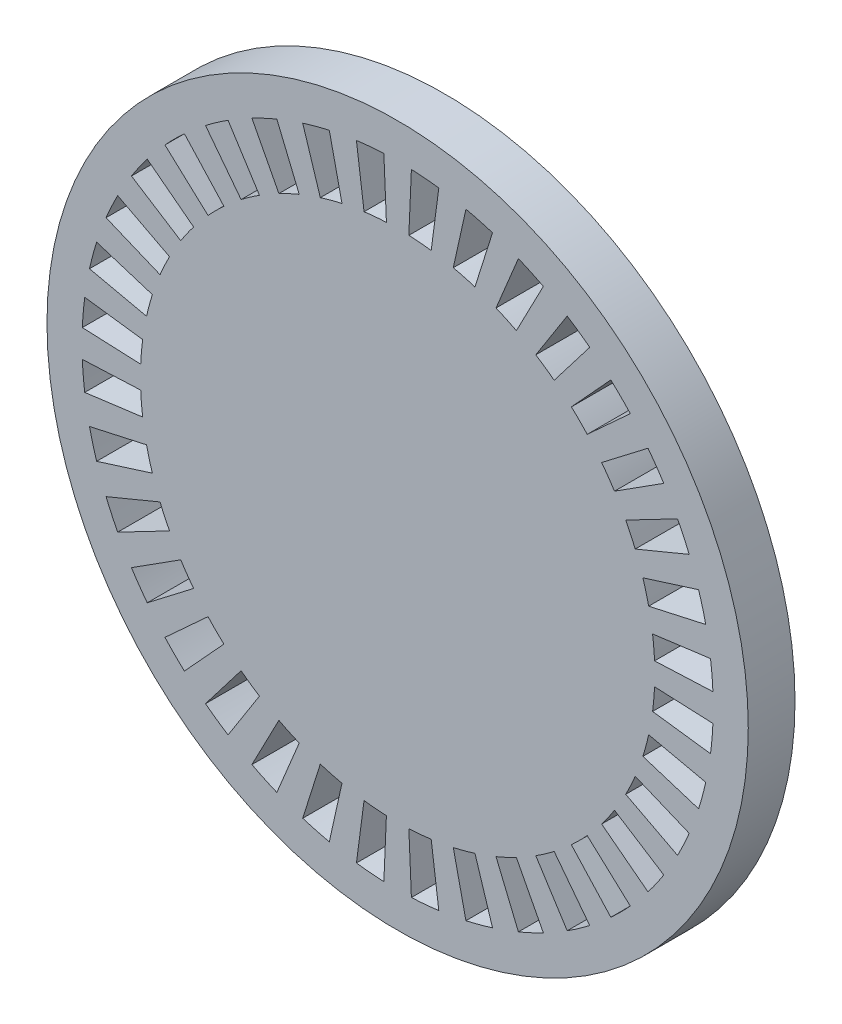
from build123d import *

# Parameters (mm, degrees)
ESQUISSE1_R        = 30
BOSS_EXTRU_1_DEPTH = 4


with BuildPart() as part:
    # Esquisse1 → Boss.-Extru.1 (new body)
    with BuildSketch(Plane.XY):
        Circle(ESQUISSE1_R)
        with BuildLine():
            Line((-26.974301983, -1.177723459), (-21.979060875, -0.959626522))
            ThreePointArc((-21.979060875, -0.959626522), (-21.916283358, -1.91742634), (-21.81178695, -2.871576229))
            Line((-21.81178695, -2.871576229), (-26.769011257, -3.52420719))
            ThreePointArc((-26.769011257, -3.52420719), (-26.897256848, -2.353205054), (-26.974301983, -1.177723459))
        make_face(mode=Mode.SUBTRACT)
        with BuildLine():
            Line((-21.979060875, 0.959626522), (-26.974301983, 1.177723459))
            ThreePointArc((-26.974301983, 1.177723459), (-26.897256848, 2.353205054), (-26.769011257, 3.52420719))
            Line((-26.769011257, 3.52420719), (-21.81178695, 2.871576229))
            ThreePointArc((-21.81178695, 2.871576229), (-21.916283358, 1.91742634), (-21.979060875, 0.959626522))
        make_face(mode=Mode.SUBTRACT)
        with BuildLine():
            ThreePointArc((-20.981772916, 6.615527589), (-21.250368178, 5.694018992), (-21.478512157, 4.761671507))
            Line((-21.478512157, 4.761671507), (-26.359992192, 5.843869576))
            ThreePointArc((-26.359992192, 5.843869576), (-26.07999731, 6.988114218), (-25.75035767, 8.119056587))
            Line((-25.75035767, 8.119056587), (-20.981772916, 6.615527589))
        make_face(mode=Mode.SUBTRACT)
        with BuildLine():
            ThreePointArc((-19.51423833, 10.158469491), (-19.938771315, 9.297601758), (-20.325349715, 8.419035512))
            Line((-20.325349715, 8.419035512), (-24.944747378, 10.332452674))
            ThreePointArc((-24.944747378, 10.332452674), (-24.47031025, 11.410693067), (-23.949292496, 12.467212557))
            Line((-23.949292496, 12.467212557), (-19.51423833, 10.158469491))
        make_face(mode=Mode.SUBTRACT)
        with BuildLine():
            ThreePointArc((-17.453773486, 13.392751438), (-18.021344974, 12.6186816), (-18.554611808, 11.820591384))
            Line((-18.554611808, 11.820591384), (-22.771569037, 14.507089425))
            ThreePointArc((-22.771569037, 14.507089425), (-22.117105196, 15.486563781), (-21.420540188, 16.436558583))
            Line((-21.420540188, 16.436558583), (-17.453773486, 13.392751438))
        make_face(mode=Mode.SUBTRACT)
        with BuildLine():
            ThreePointArc((-14.862984568, 16.22010141), (-15.556349186, 15.556349186), (-16.22010141, 14.862984568))
            Line((-16.22010141, 14.862984568), (-19.906488094, 18.240935606))
            ThreePointArc((-19.906488094, 18.240935606), (-19.091883092, 19.091883092), (-18.240935606, 19.906488094))
            Line((-18.240935606, 19.906488094), (-14.862984568, 16.22010141))
        make_face(mode=Mode.SUBTRACT)
        with BuildLine():
            ThreePointArc((-11.820591384, 18.554611808), (-12.6186816, 18.021344974), (-13.392751438, 17.453773486))
            Line((-13.392751438, 17.453773486), (-16.436558583, 21.420540188))
            ThreePointArc((-16.436558583, 21.420540188), (-15.486563781, 22.117105196), (-14.507089425, 22.771569037))
            Line((-14.507089425, 22.771569037), (-11.820591384, 18.554611808))
        make_face(mode=Mode.SUBTRACT)
        with BuildLine():
            ThreePointArc((-8.419035512, 20.325349715), (-9.297601758, 19.938771315), (-10.158469491, 19.51423833))
            Line((-10.158469491, 19.51423833), (-12.467212557, 23.949292496))
            ThreePointArc((-12.467212557, 23.949292496), (-11.410693067, 24.47031025), (-10.332452674, 24.944747378))
            Line((-10.332452674, 24.944747378), (-8.419035512, 20.325349715))
        make_face(mode=Mode.SUBTRACT)
        with BuildLine():
            ThreePointArc((-4.761671507, 21.478512157), (-5.694018992, 21.250368178), (-6.615527589, 20.981772916))
            Line((-6.615527589, 20.981772916), (-8.119056587, 25.75035767))
            ThreePointArc((-8.119056587, 25.75035767), (-6.988114218, 26.07999731), (-5.843869576, 26.359992192))
            Line((-5.843869576, 26.359992192), (-4.761671507, 21.478512157))
        make_face(mode=Mode.SUBTRACT)
        with BuildLine():
            ThreePointArc((-0.959626522, 21.979060875), (-1.91742634, 21.916283358), (-2.871576229, 21.81178695))
            Line((-2.871576229, 21.81178695), (-3.52420719, 26.769011257))
            ThreePointArc((-3.52420719, 26.769011257), (-2.353205054, 26.897256848), (-1.177723459, 26.974301983))
            Line((-1.177723459, 26.974301983), (-0.959626522, 21.979060875))
        make_face(mode=Mode.SUBTRACT)
        with BuildLine():
            ThreePointArc((2.871576229, 21.81178695), (1.91742634, 21.916283358), (0.959626522, 21.979060875))
            Line((0.959626522, 21.979060875), (1.177723459, 26.974301983))
            ThreePointArc((1.177723459, 26.974301983), (2.353205054, 26.897256848), (3.52420719, 26.769011257))
            Line((3.52420719, 26.769011257), (2.871576229, 21.81178695))
        make_face(mode=Mode.SUBTRACT)
        with BuildLine():
            ThreePointArc((6.615527589, 20.981772916), (5.694018992, 21.250368178), (4.761671507, 21.478512157))
            Line((4.761671507, 21.478512157), (5.843869576, 26.359992192))
            ThreePointArc((5.843869576, 26.359992192), (6.988114218, 26.07999731), (8.119056587, 25.75035767))
            Line((8.119056587, 25.75035767), (6.615527589, 20.981772916))
        make_face(mode=Mode.SUBTRACT)
        with BuildLine():
            ThreePointArc((10.158469491, 19.51423833), (9.297601758, 19.938771315), (8.419035512, 20.325349715))
            Line((8.419035512, 20.325349715), (10.332452674, 24.944747378))
            ThreePointArc((10.332452674, 24.944747378), (11.410693067, 24.47031025), (12.467212557, 23.949292496))
            Line((12.467212557, 23.949292496), (10.158469491, 19.51423833))
        make_face(mode=Mode.SUBTRACT)
        with BuildLine():
            ThreePointArc((13.392751438, 17.453773486), (12.6186816, 18.021344974), (11.820591384, 18.554611808))
            Line((11.820591384, 18.554611808), (14.507089425, 22.771569037))
            ThreePointArc((14.507089425, 22.771569037), (15.486563781, 22.117105196), (16.436558583, 21.420540188))
            Line((16.436558583, 21.420540188), (13.392751438, 17.453773486))
        make_face(mode=Mode.SUBTRACT)
        with BuildLine():
            ThreePointArc((16.22010141, 14.862984568), (15.556349186, 15.556349186), (14.862984568, 16.22010141))
            Line((14.862984568, 16.22010141), (18.240935606, 19.906488094))
            ThreePointArc((18.240935606, 19.906488094), (19.091883092, 19.091883092), (19.906488094, 18.240935606))
            Line((19.906488094, 18.240935606), (16.22010141, 14.862984568))
        make_face(mode=Mode.SUBTRACT)
        with BuildLine():
            ThreePointArc((18.554611808, 11.820591384), (18.021344974, 12.6186816), (17.453773486, 13.392751438))
            Line((17.453773486, 13.392751438), (21.420540188, 16.436558583))
            ThreePointArc((21.420540188, 16.436558583), (22.117105196, 15.486563781), (22.771569037, 14.507089425))
            Line((22.771569037, 14.507089425), (18.554611808, 11.820591384))
        make_face(mode=Mode.SUBTRACT)
        with BuildLine():
            ThreePointArc((20.325349715, 8.419035512), (19.938771315, 9.297601758), (19.51423833, 10.158469491))
            Line((19.51423833, 10.158469491), (23.949292496, 12.467212557))
            ThreePointArc((23.949292496, 12.467212557), (24.47031025, 11.410693067), (24.944747378, 10.332452674))
            Line((24.944747378, 10.332452674), (20.325349715, 8.419035512))
        make_face(mode=Mode.SUBTRACT)
        with BuildLine():
            ThreePointArc((21.478512157, 4.761671507), (21.250368178, 5.694018992), (20.981772916, 6.615527589))
            Line((20.981772916, 6.615527589), (25.75035767, 8.119056587))
            ThreePointArc((25.75035767, 8.119056587), (26.07999731, 6.988114218), (26.359992192, 5.843869576))
            Line((26.359992192, 5.843869576), (21.478512157, 4.761671507))
        make_face(mode=Mode.SUBTRACT)
        with BuildLine():
            ThreePointArc((21.979060875, 0.959626522), (21.916283358, 1.91742634), (21.81178695, 2.871576229))
            Line((21.81178695, 2.871576229), (26.769011257, 3.52420719))
            ThreePointArc((26.769011257, 3.52420719), (26.897256848, 2.353205054), (26.974301983, 1.177723459))
            Line((26.974301983, 1.177723459), (21.979060875, 0.959626522))
        make_face(mode=Mode.SUBTRACT)
        with BuildLine():
            ThreePointArc((21.81178695, -2.871576229), (21.916283358, -1.91742634), (21.979060875, -0.959626522))
            Line((21.979060875, -0.959626522), (26.974301983, -1.177723459))
            ThreePointArc((26.974301983, -1.177723459), (26.897256848, -2.353205054), (26.769011257, -3.52420719))
            Line((26.769011257, -3.52420719), (21.81178695, -2.871576229))
        make_face(mode=Mode.SUBTRACT)
        with BuildLine():
            ThreePointArc((20.981772916, -6.615527589), (21.250368178, -5.694018992), (21.478512157, -4.761671507))
            Line((21.478512157, -4.761671507), (26.359992192, -5.843869576))
            ThreePointArc((26.359992192, -5.843869576), (26.07999731, -6.988114218), (25.75035767, -8.119056587))
            Line((25.75035767, -8.119056587), (20.981772916, -6.615527589))
        make_face(mode=Mode.SUBTRACT)
        with BuildLine():
            ThreePointArc((19.51423833, -10.158469491), (19.938771315, -9.297601758), (20.325349715, -8.419035512))
            Line((20.325349715, -8.419035512), (24.944747378, -10.332452674))
            ThreePointArc((24.944747378, -10.332452674), (24.47031025, -11.410693067), (23.949292496, -12.467212557))
            Line((23.949292496, -12.467212557), (19.51423833, -10.158469491))
        make_face(mode=Mode.SUBTRACT)
        with BuildLine():
            ThreePointArc((17.453773486, -13.392751438), (18.021344974, -12.6186816), (18.554611808, -11.820591384))
            Line((18.554611808, -11.820591384), (22.771569037, -14.507089425))
            ThreePointArc((22.771569037, -14.507089425), (22.117105196, -15.486563781), (21.420540188, -16.436558583))
            Line((21.420540188, -16.436558583), (17.453773486, -13.392751438))
        make_face(mode=Mode.SUBTRACT)
        with BuildLine():
            ThreePointArc((14.862984568, -16.22010141), (15.556349186, -15.556349186), (16.22010141, -14.862984568))
            Line((16.22010141, -14.862984568), (19.906488094, -18.240935606))
            ThreePointArc((19.906488094, -18.240935606), (19.091883092, -19.091883092), (18.240935606, -19.906488094))
            Line((18.240935606, -19.906488094), (14.862984568, -16.22010141))
        make_face(mode=Mode.SUBTRACT)
        with BuildLine():
            ThreePointArc((11.820591384, -18.554611808), (12.6186816, -18.021344974), (13.392751438, -17.453773486))
            Line((13.392751438, -17.453773486), (16.436558583, -21.420540188))
            ThreePointArc((16.436558583, -21.420540188), (15.486563781, -22.117105196), (14.507089425, -22.771569037))
            Line((14.507089425, -22.771569037), (11.820591384, -18.554611808))
        make_face(mode=Mode.SUBTRACT)
        with BuildLine():
            ThreePointArc((8.419035512, -20.325349715), (9.297601758, -19.938771315), (10.158469491, -19.51423833))
            Line((10.158469491, -19.51423833), (12.467212557, -23.949292496))
            ThreePointArc((12.467212557, -23.949292496), (11.410693067, -24.47031025), (10.332452674, -24.944747378))
            Line((10.332452674, -24.944747378), (8.419035512, -20.325349715))
        make_face(mode=Mode.SUBTRACT)
        with BuildLine():
            ThreePointArc((4.761671507, -21.478512157), (5.694018992, -21.250368178), (6.615527589, -20.981772916))
            Line((6.615527589, -20.981772916), (8.119056587, -25.75035767))
            ThreePointArc((8.119056587, -25.75035767), (6.988114218, -26.07999731), (5.843869576, -26.359992192))
            Line((5.843869576, -26.359992192), (4.761671507, -21.478512157))
        make_face(mode=Mode.SUBTRACT)
        with BuildLine():
            ThreePointArc((0.959626522, -21.979060875), (1.91742634, -21.916283358), (2.871576229, -21.81178695))
            Line((2.871576229, -21.81178695), (3.52420719, -26.769011257))
            ThreePointArc((3.52420719, -26.769011257), (2.353205054, -26.897256848), (1.177723459, -26.974301983))
            Line((1.177723459, -26.974301983), (0.959626522, -21.979060875))
        make_face(mode=Mode.SUBTRACT)
        with BuildLine():
            ThreePointArc((-2.871576229, -21.81178695), (-1.91742634, -21.916283358), (-0.959626522, -21.979060875))
            Line((-0.959626522, -21.979060875), (-1.177723459, -26.974301983))
            ThreePointArc((-1.177723459, -26.974301983), (-2.353205054, -26.897256848), (-3.52420719, -26.769011257))
            Line((-3.52420719, -26.769011257), (-2.871576229, -21.81178695))
        make_face(mode=Mode.SUBTRACT)
        with BuildLine():
            ThreePointArc((-6.615527589, -20.981772916), (-5.694018992, -21.250368178), (-4.761671507, -21.478512157))
            Line((-4.761671507, -21.478512157), (-5.843869576, -26.359992192))
            ThreePointArc((-5.843869576, -26.359992192), (-6.988114218, -26.07999731), (-8.119056587, -25.75035767))
            Line((-8.119056587, -25.75035767), (-6.615527589, -20.981772916))
        make_face(mode=Mode.SUBTRACT)
        with BuildLine():
            ThreePointArc((-10.158469491, -19.51423833), (-9.297601758, -19.938771315), (-8.419035512, -20.325349715))
            Line((-8.419035512, -20.325349715), (-10.332452674, -24.944747378))
            ThreePointArc((-10.332452674, -24.944747378), (-11.410693067, -24.47031025), (-12.467212557, -23.949292496))
            Line((-12.467212557, -23.949292496), (-10.158469491, -19.51423833))
        make_face(mode=Mode.SUBTRACT)
        with BuildLine():
            ThreePointArc((-13.392751438, -17.453773486), (-12.6186816, -18.021344974), (-11.820591384, -18.554611808))
            Line((-11.820591384, -18.554611808), (-14.507089425, -22.771569037))
            ThreePointArc((-14.507089425, -22.771569037), (-15.486563781, -22.117105196), (-16.436558583, -21.420540188))
            Line((-16.436558583, -21.420540188), (-13.392751438, -17.453773486))
        make_face(mode=Mode.SUBTRACT)
        with BuildLine():
            ThreePointArc((-16.22010141, -14.862984568), (-15.556349186, -15.556349186), (-14.862984568, -16.22010141))
            Line((-14.862984568, -16.22010141), (-18.240935606, -19.906488094))
            ThreePointArc((-18.240935606, -19.906488094), (-19.091883092, -19.091883092), (-19.906488094, -18.240935606))
            Line((-19.906488094, -18.240935606), (-16.22010141, -14.862984568))
        make_face(mode=Mode.SUBTRACT)
        with BuildLine():
            ThreePointArc((-18.554611808, -11.820591384), (-18.021344974, -12.6186816), (-17.453773486, -13.392751438))
            Line((-17.453773486, -13.392751438), (-21.420540188, -16.436558583))
            ThreePointArc((-21.420540188, -16.436558583), (-22.117105196, -15.486563781), (-22.771569037, -14.507089425))
            Line((-22.771569037, -14.507089425), (-18.554611808, -11.820591384))
        make_face(mode=Mode.SUBTRACT)
        with BuildLine():
            ThreePointArc((-20.325349715, -8.419035512), (-19.938771315, -9.297601758), (-19.51423833, -10.158469491))
            Line((-19.51423833, -10.158469491), (-23.949292496, -12.467212557))
            ThreePointArc((-23.949292496, -12.467212557), (-24.47031025, -11.410693067), (-24.944747378, -10.332452674))
            Line((-24.944747378, -10.332452674), (-20.325349715, -8.419035512))
        make_face(mode=Mode.SUBTRACT)
        with BuildLine():
            ThreePointArc((-21.478512157, -4.761671507), (-21.250368178, -5.694018992), (-20.981772916, -6.615527589))
            Line((-20.981772916, -6.615527589), (-25.75035767, -8.119056587))
            ThreePointArc((-25.75035767, -8.119056587), (-26.07999731, -6.988114218), (-26.359992192, -5.843869576))
            Line((-26.359992192, -5.843869576), (-21.478512157, -4.761671507))
        make_face(mode=Mode.SUBTRACT)
    extrude(amount=BOSS_EXTRU_1_DEPTH)


solid = part.part
